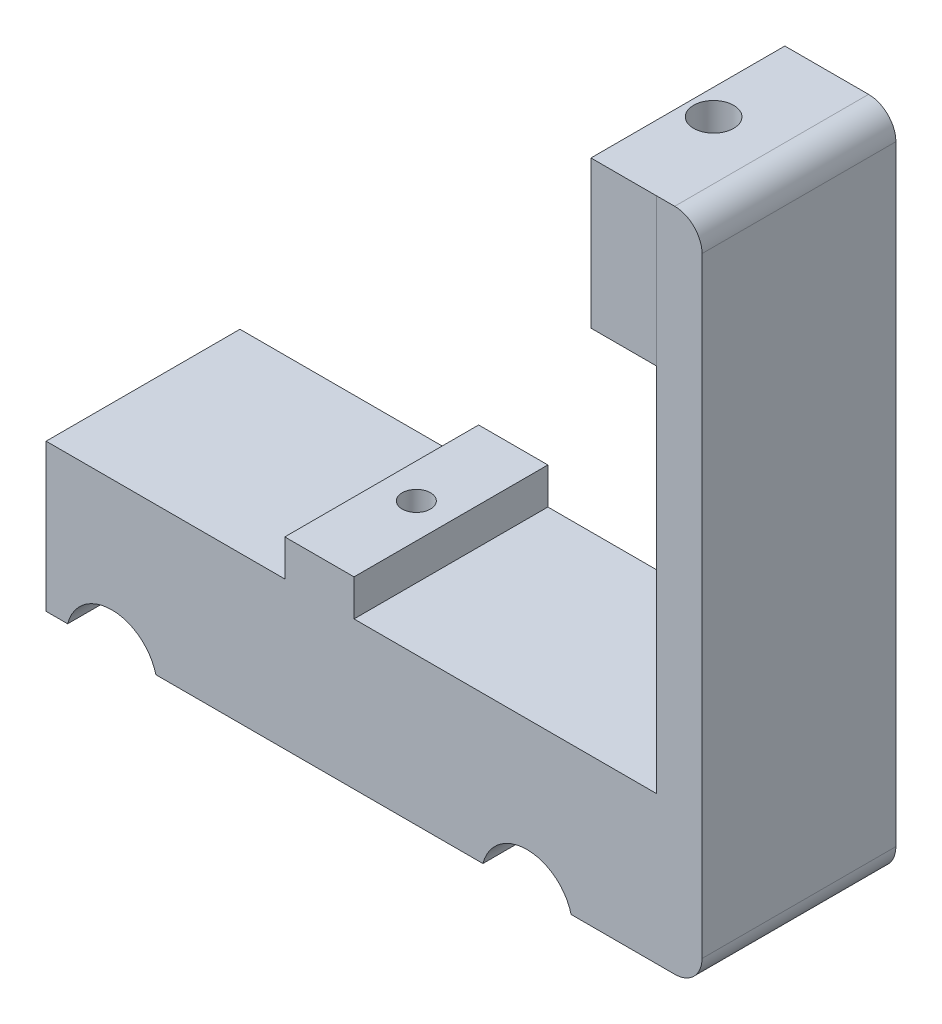
from build123d import *

# Parameters (mm, degrees)
BOSS_EXTRUDE1_DEPTH     = 10.8
BOSS_EXTRUDE2_DEPTH     = 10.64
CUT_EXTRUDE1_DEPTH      = 39.168054705
CUT_EXTRUDE1_DEPTH_BACK = 39.168054705
SKETCH5_R               = 5
FILLET1_R               = 1
SKETCH6_W               = 21.28
SKETCH6_H               = 16.18
BOSS_EXTRUDE3_DEPTH     = 12
SKETCH7_W               = 5
SKETCH7_H               = 21.281328743
BOSS_EXTRUDE4_DEPTH     = 56.83
SKETCH8_W               = 21.284331222
SKETCH8_H               = 16.18
BOSS_EXTRUDE5_DEPTH     = 7.19
FILLET3_R               = 3
SKETCH9_R               = 2.2
CUT_EXTRUDE2_DEPTH      = 85.918196519
SKETCH10_R              = 1.555
CUT_EXTRUDE3_DEPTH      = 85.918196519
SKETCH11_W              = 24.977296572
SKETCH11_H              = 9.721484234
CUT_EXTRUDE4_DEPTH      = 71.220021919


with BuildPart() as part:
    # Sketch2 → Boss-Extrude1 (new body)
    with BuildSketch(Plane.XY):
        Polygon((10.1, 0), (10.1, 1.709943763), (6.25480432, 7), (-6.25480432, 7), (-10.1, 1.709943763), (-10.1, 0), align=None)
    extrude(amount=BOSS_EXTRUDE1_DEPTH)

    # Sketch4 → Boss-Extrude2 (add, symmetric)
    with BuildSketch(Plane.XY):
        Polygon((-3.8, 0), (-3.8, -4.8), (-30, -4.8), (-30, -20.98), (30, -20.98), (30, -4.8), (3.8, -4.8), (3.8, 0), align=None)
    extrude(amount=BOSS_EXTRUDE2_DEPTH, both=True)

    # Sketch5 → Cut-Extrude1 (cut, two sides: drawn at the far end of the back side and taken through both)
    with BuildSketch(Plane.XY.offset(-CUT_EXTRUDE1_DEPTH_BACK)):
        with Locations((-22.790976064, -22.227391232)):
            Circle(SKETCH5_R)
        with Locations((22.790976064, -22.227391232)):
            Circle(SKETCH5_R)
    extrude(amount=CUT_EXTRUDE1_DEPTH + CUT_EXTRUDE1_DEPTH_BACK, mode=Mode.SUBTRACT)

    # Fillet1
    fillet1_edges = [part.edges().sort_by_distance(p)[0] for p in [
        (-10.1, 0, 5.4),
        (-10.1, 1.709943763, 5.4),
        (-6.25480432, 7, 5.4),
        (6.25480432, 7, 5.4),
        (10.1, 0, 5.4),
        (10.1, 1.709943763, 5.4),
    ]]
    fillet(fillet1_edges, radius=FILLET1_R)

    # Sketch6 → Boss-Extrude3 (add)
    with BuildSketch(Plane(origin=(30, 0, 0), x_dir=(0, 0, -1), z_dir=(1, 0, 0))):
        with Locations((0, -12.89)):
            Rectangle(SKETCH6_W, SKETCH6_H)
    extrude(amount=BOSS_EXTRUDE3_DEPTH)

    # Sketch7 → Boss-Extrude4 (add)
    with BuildSketch(Plane(origin=(0, -4.8, 0), x_dir=(1, 0, 0), z_dir=(0, 1, 0))):
        with Locations((39.5, 0.000664372)):
            Rectangle(SKETCH7_W, SKETCH7_H)
    extrude(amount=BOSS_EXTRUDE4_DEPTH)

    # Sketch8 → Boss-Extrude5 (add)
    with BuildSketch(Plane.ZY.offset(-37)):
        with Locations((0.000836868, 43.94)):
            Rectangle(SKETCH8_W, SKETCH8_H)
    extrude(amount=BOSS_EXTRUDE5_DEPTH)

    # Fillet3
    fillet3_edges = [part.edges().sort_by_distance(p)[0] for p in [
        (42, 52.03, -0.000664372),
        (42, -20.98, 0),
    ]]
    fillet(fillet3_edges, radius=FILLET3_R)

    # Sketch9 → Cut-Extrude2 (cut, through all)
    with BuildSketch(Plane.XZ.offset(20.98)):
        with Locations((32.632878078, 0)):
            Circle(SKETCH9_R)
    extrude(amount=-CUT_EXTRUDE2_DEPTH, mode=Mode.SUBTRACT)

    # Sketch10 → Cut-Extrude3 (cut, through all)
    with BuildSketch(Plane.XZ.offset(20.98)):
        with Locations((0.000925951, 0)):
            Circle(SKETCH10_R)
    extrude(amount=-CUT_EXTRUDE3_DEPTH, mode=Mode.SUBTRACT)

    # Sketch11 → Cut-Extrude4 (cut, through all)
    with BuildSketch(Plane.XY.offset(10.8)):
        with Locations((-0.121132817, 4.060742117)):
            Rectangle(SKETCH11_W, SKETCH11_H)
    extrude(amount=-CUT_EXTRUDE4_DEPTH, mode=Mode.SUBTRACT)


solid = part.part
